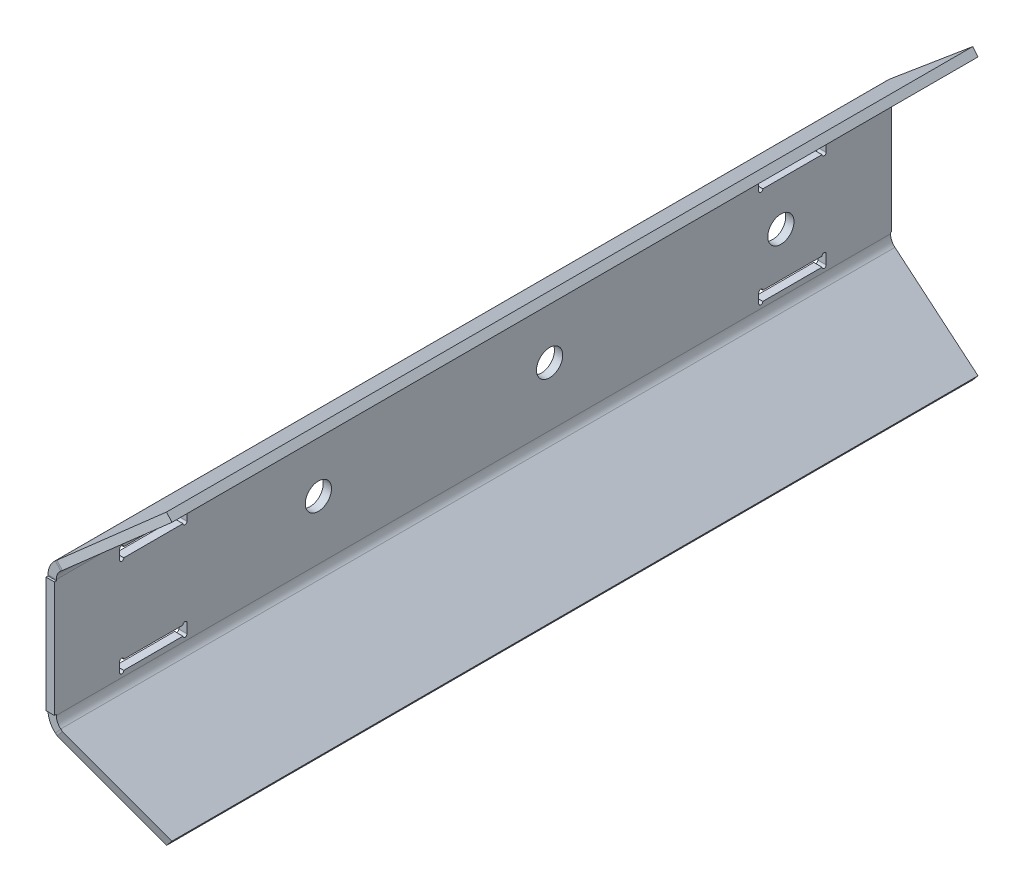
from build123d import *

# Parameters (mm, degrees)
SKETCH1_W               = 1.984375
SKETCH1_H               = 44.45
SKETCH1_W_2             = 1.5875
SKETCH1_H_2             = 41.275
BOSS_EXTRUDE1_DEPTH     = 3.175
SKETCH11_W              = 1.5875
SKETCH11_H              = 6.769262927
SKETCH11_H_2            = 6.35
BOSS_EXTRUDE2_DEPTH     = 3.175
SKETCHED_START          = -157.95625
SKETCHED_BEND1_DEPTH    = 320.675
SKETCHED_BEND1_2_DEPTH  = 320.675
SKETCHED_START_2        = -28.869188599
SKETCHED_BEND1_3_DEPTH  = 34.81577629
F_3_8_CLEARANCE_HOLE1_D = 10.0838
SKETCH9_W               = 25.908
SKETCH9_H               = 3.683
SKETCH9_W_2             = 25.4
SKETCH9_H_2             = 3.175
CUT_EXTRUDE1_DEPTH      = 176.919307022
SKETCH10_R              = 0.79375
CUT_EXTRUDE2_DEPTH      = 176.919307022


with BuildPart() as part:
    # Sketch1 → Boss-Extrude1 (new body)
    with BuildSketch(Plane(origin=(0, 0, 0), x_dir=(0, 0, -1), z_dir=(1, 0, 0))):
        Polygon((-163.5125, 22.225), (-161.13125, 22.225), (-161.13125, 25.4), (-161.13125, 28.575), (-162.71875, 28.994262927), (-151.928642345, 69.85), (156.36875, 69.85), (156.36875, -69.85), (-151.928642345, -69.85), (-162.71875, -28.994262927), (-161.13125, -28.575), (-161.13125, -25.4), (-161.13125, -22.225), (-163.5125, -22.225), align=None)
        with Locations((157.3609375, 0)):
            Rectangle(SKETCH1_W, SKETCH1_H)
        with Locations((157.1625, -49.2125)):
            Rectangle(SKETCH1_W_2, SKETCH1_H_2)
        with Locations((157.1625, 49.2125)):
            Rectangle(SKETCH1_W_2, SKETCH1_H_2)
    extrude(amount=BOSS_EXTRUDE1_DEPTH)

    # Sketch11 → Boss-Extrude2 (add)
    with BuildSketch(Plane(origin=(3.175, 0, 0), x_dir=(0, 0, -1), z_dir=(1, 0, 0))):
        with Locations((-161.925, 25.609631464)):
            Rectangle(SKETCH11_W, SKETCH11_H)
        with Locations((-161.925, -25.609631464)):
            Rectangle(SKETCH11_W, SKETCH11_H)
        with Locations((157.1625, 25.4)):
            Rectangle(SKETCH11_W, SKETCH11_H_2)
        with Locations((157.1625, -25.4)):
            Rectangle(SKETCH11_W, SKETCH11_H_2)
    extrude(amount=-BOSS_EXTRUDE2_DEPTH)

    # Sketched Bend1: read off the stored shape, not the designer's step
    # Sketched Bend1 outline → Sketched Bend1 (cut)
    with BuildSketch(Plane.XY.offset(SKETCHED_START)):
        with BuildLine():
            Line((2.835373348, 28.70976758), (3.175, 28.994748178))
            Line((3.175, 28.994748178), (3.175, 69.85))
            Line((3.175, 69.85), (0, 69.85))
            Line((0, 69.85), (0, 22.629289812))
            ThreePointArc((0, 22.629289812), (0.74368194, 25.983822265), (2.835373348, 28.70976758))
        make_face()
        with BuildLine():
            Line((3.175, -69.85), (3.175, -28.994748178))
            Line((3.175, -28.994748178), (2.835373348, -28.70976758))
            ThreePointArc((2.835373348, -28.70976758), (0.74368194, -25.983822265), (0, -22.629289812))
            Line((0, -22.629289812), (0, -69.85))
            Line((0, -69.85), (3.175, -69.85))
        make_face()
    extrude(amount=SKETCHED_BEND1_DEPTH, mode=Mode.SUBTRACT)

    # Sketched Bend1 2 outline → Sketched Bend1 2 (add)
    with BuildSketch(Plane.XY.offset(SKETCHED_START)):
        with BuildLine():
            ThreePointArc((3.175, 22.629289812), (3.621209164, 24.642009284), (4.876224009, 26.277576473))
            Line((4.876224009, 26.277576473), (36.804412363, 53.068507545))
            Line((36.804412363, 53.068507545), (34.763561702, 55.500698652))
            Line((34.763561702, 55.500698652), (3.175, 28.994748178))
            Line((3.175, 28.994748178), (3.175, 22.629289812))
        make_face()
        with BuildLine():
            ThreePointArc((4.876224009, -26.277576473), (3.621209164, -24.642009284), (3.175, -22.629289812))
            Line((3.175, -22.629289812), (3.175, -28.994748178))
            Line((3.175, -28.994748178), (34.763561702, -55.500698652))
            Line((34.763561702, -55.500698652), (36.804412363, -53.068507545))
            Line((36.804412363, -53.068507545), (4.876224009, -26.277576473))
        make_face()
    extrude(amount=SKETCHED_BEND1_2_DEPTH)

    # Sketched Bend1 3 outline → Sketched Bend1 3 (cut)
    with BuildSketch(Plane(origin=(0, 0, 0), x_dir=(0, 1, 0), z_dir=(0.9801420201505087, 0, -0.19829679860068306)).offset(SKETCHED_START_2)):
        Polygon((0, 165.039953435), (26.80694597, 160.579525039), (55.500698652, 155.80514942), (57, 155.555679513), (57, 168), (17.789728089, 168), align=None)
        Polygon((-26.80694597, 160.579525039), (0, 165.039953435), (-17.789728089, 168), (-57, 168), (-57, 155.555679513), (-55.500698652, 155.80514942), align=None)
    extrude(amount=SKETCHED_BEND1_3_DEPTH, mode=Mode.SUBTRACT)

    # 3/8 Clearance Hole1 (through all)
    with Locations(Plane(origin=(3.175, 0, 0), x_dir=(0, 0, -1), z_dir=(1, 0, 0))):
        with Locations((115.808125, 0), (26.908125, 0), (-61.991875, 0)):
            Hole(F_3_8_CLEARANCE_HOLE1_D / 2)

    # Sketch9 → Cut-Extrude1 (cut, through all)
    # profile 1 of 4: a face of its own
    with BuildSketch(Plane(origin=(3.175, 0, 0), x_dir=(0, 0, -1), z_dir=(1, 0, 0))):
        with Locations((-125.4125, 18.7325)):
            Rectangle(SKETCH9_W, SKETCH9_H)
        with Locations((-125.4125, 18.7325)):
            Rectangle(SKETCH9_W_2, SKETCH9_H_2, mode=Mode.SUBTRACT)
    # profile 2 of 4: a face of its own
    with BuildSketch(Plane(origin=(3.175, 0, 0), x_dir=(0, 0, -1), z_dir=(1, 0, 0))):
        with Locations((-125.4125, -18.7325)):
            Rectangle(SKETCH9_W, SKETCH9_H)
        with Locations((-125.4125, -18.7325)):
            Rectangle(SKETCH9_W_2, SKETCH9_H_2, mode=Mode.SUBTRACT)
    # profile 3 of 4: a face of its own
    with BuildSketch(Plane(origin=(3.175, 0, 0), x_dir=(0, 0, -1), z_dir=(1, 0, 0))):
        with Locations((120.253125, 18.7325)):
            Rectangle(SKETCH9_W, SKETCH9_H)
        with Locations((120.253125, 18.7325)):
            Rectangle(SKETCH9_W_2, SKETCH9_H_2, mode=Mode.SUBTRACT)
    # profile 4 of 4: a face of its own
    with BuildSketch(Plane(origin=(3.175, 0, 0), x_dir=(0, 0, -1), z_dir=(1, 0, 0))):
        with Locations((120.253125, -18.7325)):
            Rectangle(SKETCH9_W, SKETCH9_H)
        with Locations((120.253125, -18.7325)):
            Rectangle(SKETCH9_W_2, SKETCH9_H_2, mode=Mode.SUBTRACT)
    extrude(amount=-CUT_EXTRUDE1_DEPTH, mode=Mode.SUBTRACT)


with BuildPart() as body_2:
    # of the pieces the cut leaves, the one that is kept (cut_extrude1_keep)
    add(part.part.solids().sort_by_distance((0, 22.225, 163.5125))[0])

    # Sketch10 → Cut-Extrude2 (cut, through all)
    with BuildSketch(Plane(origin=(3.175, 0, 0), x_dir=(0, 0, -1), z_dir=(1, 0, 0))):
        with Locations((108.092875, 16.891)):
            Circle(SKETCH10_R)
        with Locations((108.092875, 20.574)):
            Circle(SKETCH10_R)
        with Locations((132.413375, 20.574)):
            Circle(SKETCH10_R)
        with Locations((132.413375, 16.891)):
            Circle(SKETCH10_R)
        with Locations((132.413375, -16.891)):
            Circle(SKETCH10_R)
        with Locations((132.413375, -20.574)):
            Circle(SKETCH10_R)
        with Locations((108.092875, -20.574)):
            Circle(SKETCH10_R)
        with Locations((108.092875, -16.891)):
            Circle(SKETCH10_R)
        with Locations((-113.25225, -16.891)):
            Circle(SKETCH10_R)
        with Locations((-113.25225, -20.574)):
            Circle(SKETCH10_R)
        with Locations((-137.57275, -20.574)):
            Circle(SKETCH10_R)
        with Locations((-137.57275, -16.891)):
            Circle(SKETCH10_R)
        with Locations((-137.57275, 16.891)):
            Circle(SKETCH10_R)
        with Locations((-137.57275, 20.574)):
            Circle(SKETCH10_R)
        with Locations((-113.25225, 20.574)):
            Circle(SKETCH10_R)
        with Locations((-113.25225, 16.891)):
            Circle(SKETCH10_R)
    extrude(amount=-CUT_EXTRUDE2_DEPTH, mode=Mode.SUBTRACT)


solid = body_2.part
